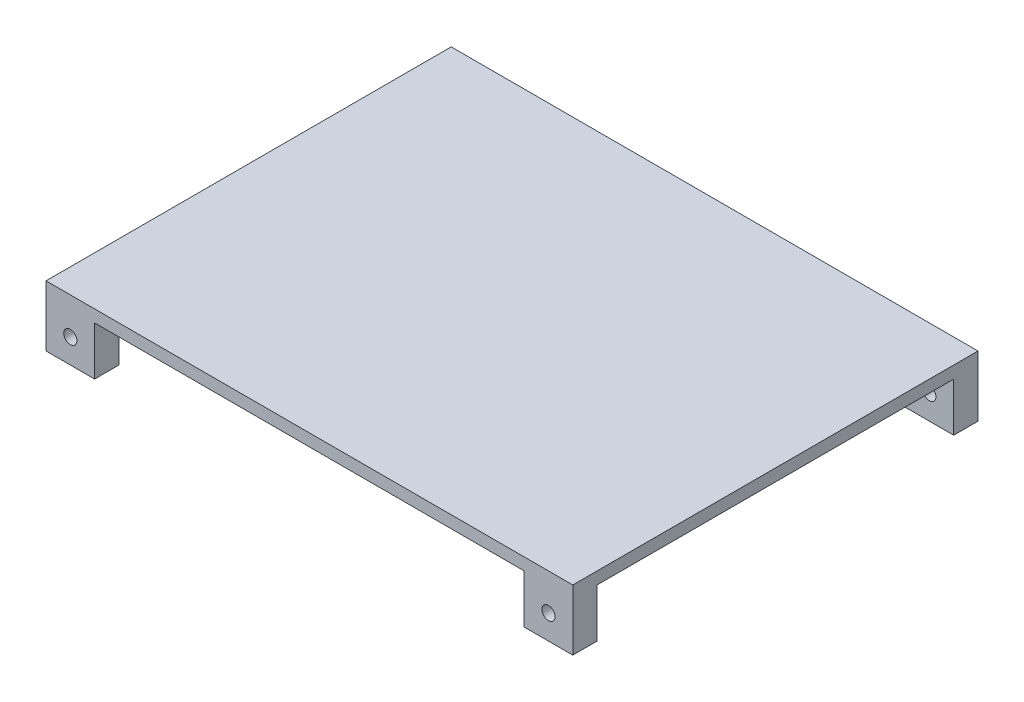
from build123d import *

# Parameters (mm, degrees)
SKETCH1_W           = 130
SKETCH1_H           = 100
BOSS_EXTRUDE1_DEPTH = 3
SKETCH2_W           = 12
SKETCH2_H           = 6
BOSS_EXTRUDE2_DEPTH = 12
SKETCH4_R           = 1.625
CUT_EXTRUDE1_DEPTH  = 165.450600485


with BuildPart() as part:
    # Sketch1 → Boss-Extrude1 (new body)
    with BuildSketch(Plane(origin=(0, 0, 0), x_dir=(1, 0, 0), z_dir=(0, 1, 0))):
        with Locations((65, 50)):
            Rectangle(SKETCH1_W, SKETCH1_H)
    extrude(amount=BOSS_EXTRUDE1_DEPTH)

    # Sketch2 → Boss-Extrude2 (add)
    with BuildSketch(Plane.XZ):
        with Locations((6, -3)):
            Rectangle(SKETCH2_W, SKETCH2_H)
        with Locations((124, -3)):
            Rectangle(SKETCH2_W, SKETCH2_H)
        with Locations((124, -97)):
            Rectangle(SKETCH2_W, SKETCH2_H)
        with Locations((6, -97)):
            Rectangle(SKETCH2_W, SKETCH2_H)
    extrude(amount=BOSS_EXTRUDE2_DEPTH)

    # Sketch4 → Cut-Extrude1 (cut, through all)
    with BuildSketch(Plane.XY):
        with Locations((6, -6)):
            Circle(SKETCH4_R)
        with Locations((124, -6)):
            Circle(SKETCH4_R)
    extrude(amount=-CUT_EXTRUDE1_DEPTH, mode=Mode.SUBTRACT)


solid = part.part
